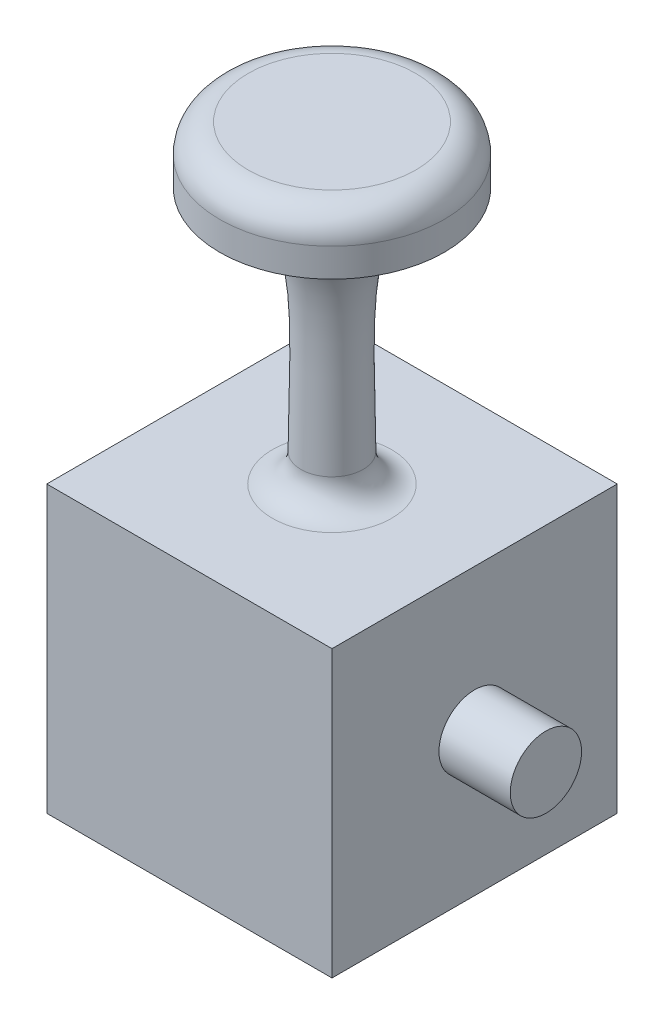
from build123d import *

# Parameters (mm, degrees)
SKETCH2_W          = 25.4
SKETCH2_H          = 25.4
CENTRAL_BOX_DEPTH  = 25.4
NIBBLES_DEPTH      = 6.35
NIBBLES_DEPTH_BACK = 31.75
SKETCH4_R          = 3.175
YAY_ROUNDED_R      = 2.54


with BuildPart() as part:
    # Sketch2 → central box (new body)
    with BuildSketch(Plane(origin=(0, 0, 0), x_dir=(0, 0, -1), z_dir=(1, 0, 0))):
        with Locations((12.7, 12.7)):
            Rectangle(SKETCH2_W, SKETCH2_H)
    extrude(amount=CENTRAL_BOX_DEPTH)

    # Sketch4 → nibbles (add, two sides: drawn at the far end of the back side and taken through both)
    with BuildSketch(Plane(origin=(25.4, 0, 0), x_dir=(0, 0, -1), z_dir=(1, 0, 0)).offset(-NIBBLES_DEPTH_BACK)):
        with Locations((12.7, 12.7)):
            Circle(SKETCH4_R)
    extrude(amount=NIBBLES_DEPTH + NIBBLES_DEPTH_BACK)

    # Sketch6 → stick (revolve)
    with BuildSketch(Plane.XY.offset(-12.7)):
        with BuildLine():
            Line((12.7, 25.4), (12.7, 53.34))
            Line((12.7, 53.34), (22.69993783, 53.34))
            Line((22.69993783, 53.34), (22.69993783, 48.26))
            add(Edge.make_bspline(
                [(22.69993783, 48.26), (14.011650276, 48.351463028), (15.389137078, 40.654769041), (15.494, 25.4)],
                knots=[0, 0, 0, 0, 1, 1, 1, 1], degree=3))
            Line((15.494, 25.4), (12.7, 25.4))
        make_face()
    revolve(axis=Axis((12.7, 25.4, -12.7), (0, 1, 0)))

    # yay, rounded
    yay_rounded_edges = [part.edges().sort_by_distance(p)[0] for p in [
        (9.906, 25.4, -12.7),
        (2.70006217, 53.34, -12.7),
    ]]
    fillet(yay_rounded_edges, radius=YAY_ROUNDED_R)


solid = part.part
